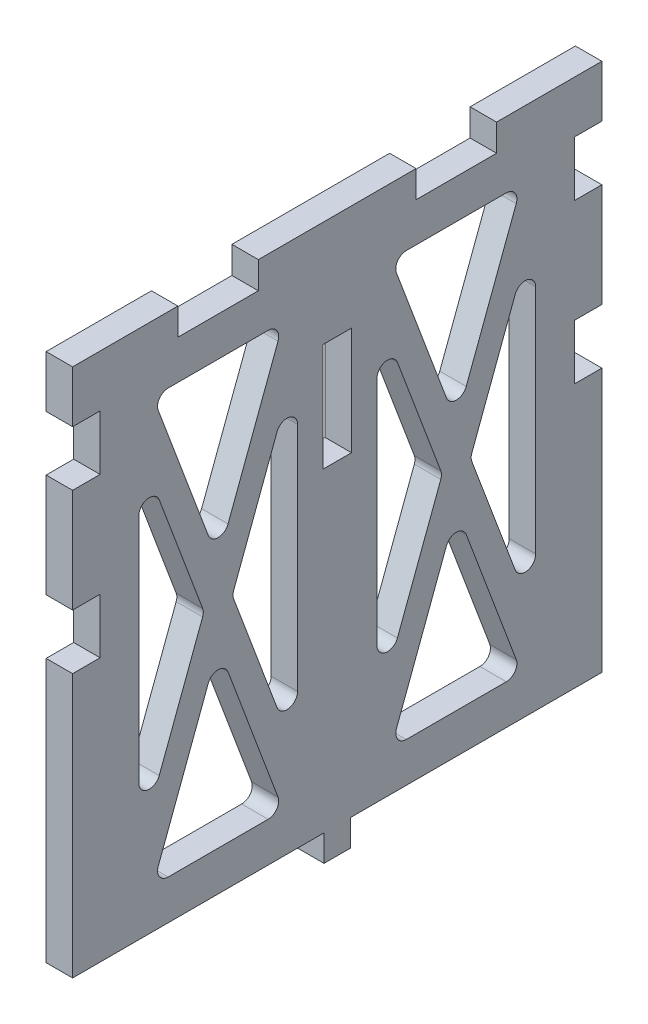
from build123d import *

# Parameters (mm, degrees)
SKETCH4_W           = 6.858
SKETCH4_H           = 25.908
BOSS_EXTRUDE1_DEPTH = 6.35
CUT_EXTRUDE1_DEPTH  = 150.225
FILLET1_R           = 2.54


with BuildPart() as part:
    # Sketch4 → Boss-Extrude1 (new body)
    with BuildSketch(Plane(origin=(0, 0, 0), x_dir=(0, 0, -1), z_dir=(1, 0, 0))):
        Polygon((0, 6.35), (-60.325, 6.35), (-60.325, 69.596), (-53.721, 69.596), (-53.721, 82.804), (-60.325, 82.804), (-60.325, 107.696), (-53.721, 107.696), (-53.721, 120.904), (-60.325, 120.904), (-60.325, 133.35), (-35.052, 133.35), (-35.052, 126.873), (-15.748, 126.873), (-15.748, 133.35), (22.098, 133.35), (22.098, 126.873), (41.402, 126.873), (41.402, 133.35), (66.675, 133.35), (66.675, 120.904), (60.071, 120.904), (60.071, 107.696), (66.675, 107.696), (66.675, 82.804), (60.071, 82.804), (60.071, 69.596), (66.675, 69.596), (66.675, 6.35), (6.35, 6.35), (6.35, 0), (0, 0), align=None)
        with Locations((3.175, 94.996)):
            Rectangle(SKETCH4_W, SKETCH4_H, mode=Mode.SUBTRACT)
    extrude(amount=BOSS_EXTRUDE1_DEPTH)

    # Sketch5 → Cut-Extrude1 (cut, through all)
    with BuildSketch(Plane(origin=(6.35, 0, 0), x_dir=(0, 0, -1), z_dir=(1, 0, 0))):
        Polygon((-9.740901486, 117.475), (-41.059098514, 117.475), (-25.4, 75.717403964), align=None)
        Polygon((-28.790901486, 66.675), (-44.45, 108.432596036), (-44.45, 24.917403964), align=None)
        Polygon((-6.35, 108.432596036), (-22.009098514, 66.675), (-6.35, 24.917403964), align=None)
        Polygon((-9.740901486, 15.875), (-25.4, 57.632596036), (-41.059098514, 15.875), align=None)
        Polygon((47.409098514, 117.475), (16.090901486, 117.475), (31.75, 75.717403964), align=None)
        Polygon((28.359098514, 66.675), (12.7, 108.432596036), (12.7, 24.917403964), align=None)
        Polygon((50.8, 108.432596036), (35.140901486, 66.675), (50.8, 24.917403964), align=None)
        Polygon((47.409098514, 15.875), (31.75, 57.632596036), (16.090901486, 15.875), align=None)
    extrude(amount=-CUT_EXTRUDE1_DEPTH, mode=Mode.SUBTRACT)

    # Fillet1
    fillet1_edges = [part.edges().sort_by_distance(p)[0] for p in [
        (3.175, 57.632596036, 25.4),
        (3.175, 15.875, 9.740901486),
        (3.175, 15.875, 41.059098514),
        (3.175, 108.432596036, 6.35),
        (3.175, 24.917403964, 6.35),
        (3.175, 66.675, 22.009098514),
        (3.175, 57.632596036, -31.75),
        (3.175, 15.875, -47.409098514),
        (3.175, 15.875, -16.090901486),
        (3.175, 66.675, -35.140901486),
        (3.175, 108.432596036, -50.8),
        (3.175, 24.917403964, -50.8),
        (3.175, 66.675, 28.790901486),
        (3.175, 24.917403964, 44.45),
        (3.175, 108.432596036, 44.45),
        (3.175, 117.475, -16.090901486),
        (3.175, 117.475, -47.409098514),
        (3.175, 75.717403964, -31.75),
        (3.175, 117.475, 9.740901486),
        (3.175, 75.717403964, 25.4),
        (3.175, 108.432596036, -12.7),
        (3.175, 66.675, -28.359098514),
        (3.175, 24.917403964, -12.7),
        (3.175, 117.475, 41.059098514),
    ]]
    fillet(fillet1_edges, radius=FILLET1_R)


solid = part.part
